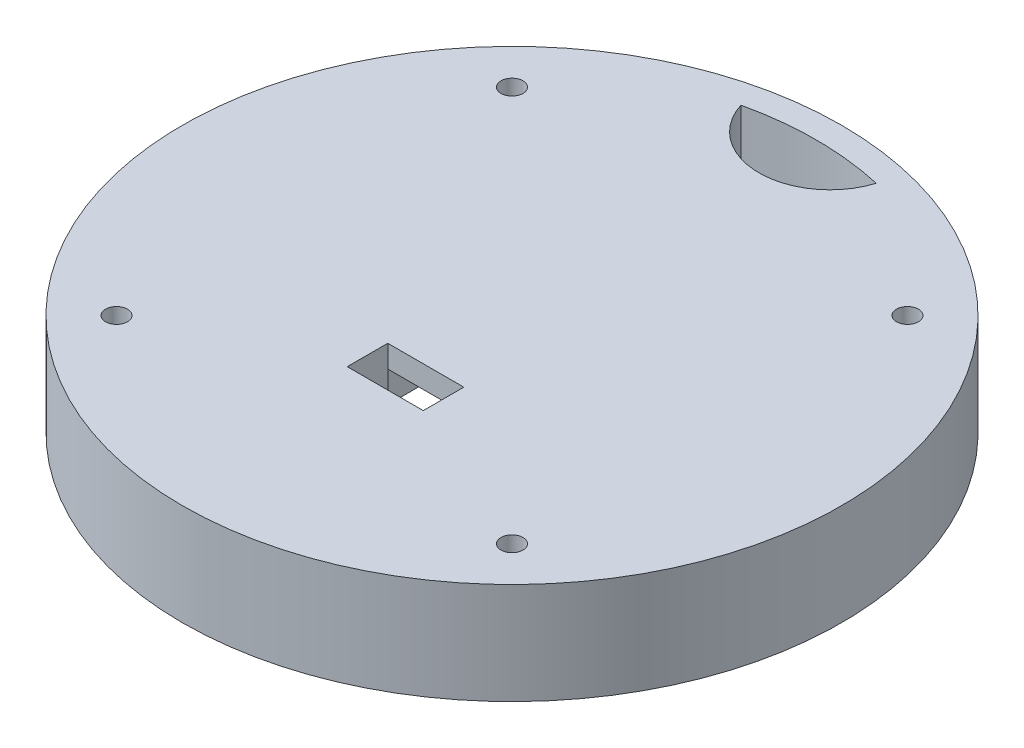
from build123d import *

# Parameters (mm, degrees)
SKETCH1_R           = 82.55
BOSS_EXTRUDE3_DEPTH = 25.4
CUT_EXTRUDE1_DEPTH  = 2540
SKETCH1_7_W         = 43.18
SKETCH1_7_H         = 43.18
CUT_EXTRUDE2_DEPTH  = 19.812
SKETCH3_W           = 19.05
SKETCH3_H           = 10.16
CUT_EXTRUDE3_DEPTH  = 120.474537036
SKETCH1_8_R         = 2.75
CUT_EXTRUDE4_DEPTH  = 6
CUT_EXTRUDE5_START  = 19.4
SKETCH1_10_R        = 2.75
CUT_EXTRUDE5_DEPTH  = 6


with BuildPart() as part:
    # Sketch1 → Boss-Extrude3 (new body)
    with BuildSketch(Plane(origin=(0, 0, 0), x_dir=(1, 0, 0), z_dir=(0, 1, 0))):
        Circle(SKETCH1_R)
    extrude(amount=BOSS_EXTRUDE3_DEPTH)

    # Sketch1<6> → Cut-Extrude1 (cut)
    with BuildSketch(Plane(origin=(0, 0, 0), x_dir=(1, 0, 0), z_dir=(0, 1, 0))):
        with BuildLine():
            ThreePointArc((16.956095167, 74.289506908), (0, 76.2), (-16.956095167, 74.289506908))
            ThreePointArc((-16.956095167, 74.289506908), (0, 61.859201916), (16.956095167, 74.289506908))
        make_face()
    extrude(amount=CUT_EXTRUDE1_DEPTH, mode=Mode.SUBTRACT)

    # Sketch1<7> → Cut-Extrude2 (cut)
    with BuildSketch(Plane(origin=(0, 0, 0), x_dir=(1, 0, 0), z_dir=(0, 1, 0))):
        Rectangle(SKETCH1_7_W, SKETCH1_7_H)
    extrude(amount=CUT_EXTRUDE2_DEPTH, mode=Mode.SUBTRACT)

    # Sketch3 → Cut-Extrude3 (cut, through all)
    with BuildSketch(Plane.XZ):
        with Locations((0, 26.67)):
            Rectangle(SKETCH3_W, SKETCH3_H)
    extrude(amount=-CUT_EXTRUDE3_DEPTH, mode=Mode.SUBTRACT)

    # Sketch1<8> → Cut-Extrude4 (cut)
    with BuildSketch(Plane(origin=(0, 0, 0), x_dir=(1, 0, 0), z_dir=(0, 1, 0))):
        with Locations((-49.53, 49.53)):
            Circle(SKETCH1_8_R)
        with Locations((49.53, 49.53)):
            Circle(SKETCH1_8_R)
        with Locations((49.53, -49.53)):
            Circle(SKETCH1_8_R)
        with Locations((-49.53, -49.53)):
            Circle(SKETCH1_8_R)
    extrude(amount=CUT_EXTRUDE4_DEPTH, mode=Mode.SUBTRACT)

    # Sketch1<10> → Cut-Extrude5 (cut)
    with BuildSketch(Plane(origin=(0, 0, 0), x_dir=(1, 0, 0), z_dir=(0, 1, 0)).offset(CUT_EXTRUDE5_START)):
        with Locations((-49.53, 49.53)):
            Circle(SKETCH1_10_R)
        with Locations((49.53, 49.53)):
            Circle(SKETCH1_10_R)
        with Locations((49.53, -49.53)):
            Circle(SKETCH1_10_R)
        with Locations((-49.53, -49.53)):
            Circle(SKETCH1_10_R)
    extrude(amount=CUT_EXTRUDE5_DEPTH, mode=Mode.SUBTRACT)


solid = part.part
